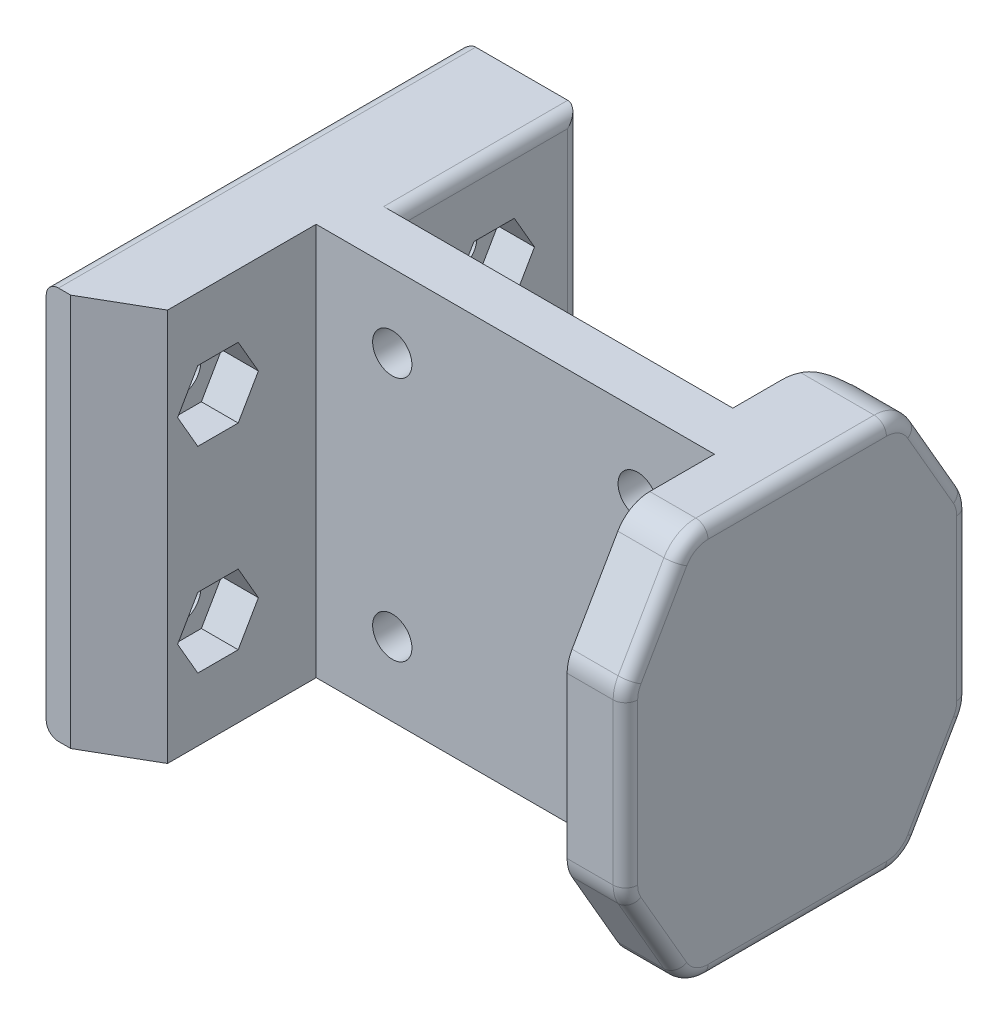
from build123d import *

# Parameters (mm, degrees)
SKETCH_1_W          = 36
SKETCH_1_H          = 32
SKETCH_1_R          = 1.6
EXTRUDE_1_DEPTH     = 4
EXTRUDE_2_DEPTH     = 32
SKETCH_8_R          = 1.6
CUT_EXTRUDE_1_DEPTH = 53.619768148
SKETCH1_W           = 4
SKETCH1_H           = 32
BOSS_EXTRUDE1_DEPTH = 3
SKETCH2_W           = 5
SKETCH2_H           = 32
BOSS_EXTRUDE2_DEPTH = 12
CUT_EXTRUDE1_DEPTH  = 5
BOSS_EXTRUDE5_DEPTH = 5
BOSS_EXTRUDE6_START = 3
SKETCH7_W           = 15
SKETCH7_H           = 32
SKETCH7_R           = 1.6
BOSS_EXTRUDE6_DEPTH = 3
CUT_EXTRUDE2_DEPTH  = 0.25
BOSS_EXTRUDE7_START = 2.5
SKETCH9_W           = 15
SKETCH9_H           = 32
SKETCH9_R           = 1.6
BOSS_EXTRUDE7_DEPTH = 2.5
BOSS_EXTRUDE8_DEPTH = 2.5
CUT_EXTRUDE3_DEPTH  = 2.5
FILLET2_R           = 3
FILLET4_R           = 3
FILLET5_R           = 3
FILLET9_R           = 1
CUT_EXTRUDE4_DEPTH  = 3
CUT_EXTRUDE5_DEPTH  = 3
FILLET14_R          = 1
CHAMFER_1_SIZE      = 5
CHAMFER_1_SIZE2     = 2.886751346


with BuildPart() as part:
    # Эскиз1 → Бобышка-Вытянуть1 (new body)
    with BuildSketch(Plane.XY):
        with Locations((18, 16)):
            Rectangle(SKETCH_1_W, SKETCH_1_H)
        with Locations((8, 26)):
            Circle(SKETCH_1_R, mode=Mode.SUBTRACT)
        with Locations((28, 26)):
            Circle(SKETCH_1_R, mode=Mode.SUBTRACT)
        with Locations((8, 6)):
            Circle(SKETCH_1_R, mode=Mode.SUBTRACT)
        with Locations((28, 6)):
            Circle(SKETCH_1_R, mode=Mode.SUBTRACT)
    extrude(amount=EXTRUDE_1_DEPTH)

    # Эскиз7 → Бобышка-Вытянуть2 (add)
    with BuildSketch(Plane(origin=(0, 32, 0), x_dir=(1, 0, 0), z_dir=(0, 1, 0))):
        Polygon((0, 0), (-1.2, 0), (-1.2, 15), (-5.2, 15), (-5.2, -19), (-1.2, -19), (-1.2, -4), (0, -4), align=None)
    extrude(amount=-EXTRUDE_2_DEPTH)

    # Эскиз8 → Вырез-Вытянуть1 (cut, through all)
    with BuildSketch(Plane(origin=(-1.2, 0, 0), x_dir=(0, 0, -1), z_dir=(1, 0, 0))):
        with Locations(Location((8, 24, 0), (0, 0, 90))):
            Circle(SKETCH_8_R)
        with Locations(Location((8, 8, 0), (0, 0, 90))):
            Circle(SKETCH_8_R)
        with Locations(Location((-12, 8, 0), (0, 0, 90))):
            Circle(SKETCH_8_R)
        with Locations(Location((-12, 24, 0), (0, 0, 90))):
            Circle(SKETCH_8_R)
    extrude(amount=-CUT_EXTRUDE_1_DEPTH, mode=Mode.SUBTRACT)

    # Sketch1 → Boss-Extrude1 (add)
    with BuildSketch(Plane(origin=(36, 0, 0), x_dir=(0, 0, -1), z_dir=(1, 0, 0))):
        with Locations((-2, 16)):
            Rectangle(SKETCH1_W, SKETCH1_H)
    extrude(amount=BOSS_EXTRUDE1_DEPTH)

    # Sketch2 → Boss-Extrude2 (add)
    with BuildSketch(Plane(origin=(0, 0, 0), x_dir=(-1, 0, 0), z_dir=(0, 0, -1))):
        with Locations((-36.5, 16)):
            Rectangle(SKETCH2_W, SKETCH2_H)
    extrude(amount=BOSS_EXTRUDE2_DEPTH)

    # Sketch3 → Cut-Extrude1 (cut)
    with BuildSketch(Plane(origin=(39, 0, 0), x_dir=(0, 0, -1), z_dir=(1, 0, 0))):
        Polygon((7, 32), (12, 32), (12, 23.339745962), align=None)
        Polygon((12, 8.660254038), (7, 0), (12, 0), align=None)
    extrude(amount=-CUT_EXTRUDE1_DEPTH, mode=Mode.SUBTRACT)

    # Sketch6 → Boss-Extrude5 (add)
    with BuildSketch(Plane(origin=(39, 0, 0), x_dir=(0, 0, -1), z_dir=(1, 0, 0))):
        Polygon((-16, 8.660254038), (-11, 0), (-4, 0), (-4, 32), (-11, 32), (-16, 23.339745962), align=None)
    extrude(amount=-BOSS_EXTRUDE5_DEPTH)

    # Sketch7 → Boss-Extrude6 (add)
    # profile 1 of 2: a face of its own
    with BuildSketch(Plane(origin=(-1.2, 0, 0), x_dir=(0, 0, -1), z_dir=(1, 0, 0)).offset(BOSS_EXTRUDE6_START)):
        with Locations((7.5, 16)):
            Rectangle(SKETCH7_W, SKETCH7_H)
        with Locations(Location((8, 24, 0), (0, 0, 90))):
            Circle(SKETCH7_R, mode=Mode.SUBTRACT)
        with Locations(Location((8, 8, 0), (0, 0, 90))):
            Circle(SKETCH7_R, mode=Mode.SUBTRACT)
    # profile 2 of 2: a face of its own
    with BuildSketch(Plane(origin=(-1.2, 0, 0), x_dir=(0, 0, -1), z_dir=(1, 0, 0)).offset(BOSS_EXTRUDE6_START)):
        with Locations((-11.5, 16)):
            Rectangle(SKETCH7_W, SKETCH7_H)
        with Locations(Location((-12, 24, 0), (0, 0, 90))):
            Circle(SKETCH7_R, mode=Mode.SUBTRACT)
        with Locations(Location((-12, 8, 0), (0, 0, 90))):
            Circle(SKETCH7_R, mode=Mode.SUBTRACT)
    extrude(amount=-BOSS_EXTRUDE6_DEPTH)

    # Sketch8 → Cut-Extrude2 (cut)
    with BuildSketch(Plane.ZY.offset(-34)):
        Polygon((-12, 23.339745962), (-12, 8.660254038), (-7, 0), (0, 0), (0, 32), (-7, 32), align=None)
        Polygon((4, 32), (4, 0), (11, 0), (16, 8.660254038), (16, 23.339745962), (11, 32), align=None)
    extrude(amount=-CUT_EXTRUDE2_DEPTH, mode=Mode.SUBTRACT)

    # Sketch9 → Boss-Extrude7 (add)
    with BuildSketch(Plane(origin=(1.8, 0, 0), x_dir=(0, 0, -1), z_dir=(1, 0, 0)).offset(BOSS_EXTRUDE7_START)):
        with Locations((7.5, 16)):
            Rectangle(SKETCH9_W, SKETCH9_H)
        with Locations(Location((8, 24, 0), (0, 0, 90))):
            Circle(SKETCH9_R, mode=Mode.SUBTRACT)
        with Locations(Location((8, 8, 0), (0, 0, 90))):
            Circle(SKETCH9_R, mode=Mode.SUBTRACT)
    extrude(amount=-BOSS_EXTRUDE7_DEPTH)

    # Sketch10 → Boss-Extrude8 (add)
    with BuildSketch(Plane.ZY.offset(-34.25)):
        Polygon((-7, 32), (-12, 23.339745962), (-12, 8.660254038), (-7, 0), (0, 0), (0, 32), align=None)
    extrude(amount=BOSS_EXTRUDE8_DEPTH)

    # Sketch11 → Cut-Extrude3 (cut)
    with BuildSketch(Plane.ZY.offset(-31.75)):
        Polygon((-7, 32), (-12, 23.339745962), (-12, 8.660254038), (-7, 0), align=None)
    extrude(amount=-CUT_EXTRUDE3_DEPTH, mode=Mode.SUBTRACT)

    # Fillet2
    # the kernel refuses this fillet: 3 mm, written as the material it takes off along each edge
    with BuildSketch(Plane(origin=(31.75, -7.395099729, -7), x_dir=(1, 0, 0), z_dir=(0, 1, 0))) as fillet2_piece_1:
        with BuildLine():
            CenterArc((3, -2.958039892), FILLET2_R, 99.594068227, 80.405931773)
            Line((0, -2.958039892), (-0.06, -2.958039892))
            Line((-0.06, -2.958039892), (-0.06, 0))
            Line((-0.06, 0), (0, 0.06))
            ThreePointArc((0, 0.06), (1.25, 0.06), (2.49, 0.059160798))
            Line((2.49, 0.059160798), (2.5, 0))
        make_face()
    extrude(amount=46.790199458, mode=Mode.SUBTRACT)

    # Fillet4
    fillet4_edges = [part.edges().sort_by_distance(p)[0] for p in [
        (36.625, 32, -7),
        (36.625, 0, -7),
        (36.625, 8.660254038, -12),
        (36.625, 23.339745962, -12),
    ]]
    fillet(fillet4_edges, radius=FILLET4_R)

    # Fillet5
    fillet5_edges = [part.edges().sort_by_distance(p)[0] for p in [
        (36.625, 32, 11),
        (36.625, 23.339745962, 16),
        (36.625, 8.660254038, 16),
        (36.625, 0, 11),
    ]]
    fillet(fillet5_edges, radius=FILLET5_R)

    # Fillet9
    fillet9_edges = [part.edges().sort_by_distance(p)[0] for p in [
        (39, 4.732050808, -9.732050808),
        (39, 16, -12),
        (39, 27.267949192, -9.732050808),
        (39, 32, 2),
        (39, 31.598076211, -6.767949192),
        (39, 23.31235552, -11.897777479),
        (39, 8.68764448, -11.897777479),
        (39, 0.401923789, -6.767949192),
        (39, 4.732050808, 13.732050808),
        (39, 0, 2),
        (39, 27.267949192, 13.732050808),
        (39, 16, 16),
        (39, 31.598076211, 10.767949192),
        (39, 23.31235552, 15.897777479),
        (39, 8.68764448, 15.897777479),
        (39, 0.401923789, 10.767949192),
    ]]
    fillet(fillet9_edges, radius=FILLET9_R)

    # Sketch12 → Cut-Extrude4 (cut)
    with BuildSketch(Plane(origin=(4.3, 0, 0), x_dir=(0, 0, -1), z_dir=(1, 0, 0))):
        Polygon((6.354551733, 26.85), (4.709103466, 24), (6.354551733, 21.15), (9.645448267, 21.15), (11.290896534, 24), (9.645448267, 26.85), align=None)
        Polygon((6.354551733, 10.85), (4.709103466, 8), (6.354551733, 5.15), (9.645448267, 5.15), (11.290896534, 8), (9.645448267, 10.85), align=None)
    extrude(amount=-CUT_EXTRUDE4_DEPTH, mode=Mode.SUBTRACT)

    # Sketch13 → Cut-Extrude5 (cut)
    with BuildSketch(Plane(origin=(1.8, 0, 0), x_dir=(0, 0, -1), z_dir=(1, 0, 0))):
        Polygon((-15.290896534, 24), (-13.645448267, 21.15), (-10.354551733, 21.15), (-8.709103466, 24), (-10.354551733, 26.85), (-13.645448267, 26.85), align=None)
        Polygon((-15.290896534, 8), (-13.645448267, 5.15), (-10.354551733, 5.15), (-8.709103466, 8), (-10.354551733, 10.85), (-13.645448267, 10.85), align=None)
    extrude(amount=-CUT_EXTRUDE5_DEPTH, mode=Mode.SUBTRACT)

    # Fillet14
    fillet14_edges = [part.edges().sort_by_distance(p)[0] for p in [
        (4.3, 32, -7.5),
        (4.3, 0, -7.5),
        (4.3, 16, -15),
        (-5.2, 16, -15),
        (-5.2, 32, 2),
        (-5.2, 0, 2),
    ]]
    fillet(fillet14_edges, radius=FILLET14_R)

    # Фаска1
    chamfer_1_edges = [part.edges().sort_by_distance(p)[0] for p in [
        (1.8, 16, 19),
    ]]
    chamfer_1_side = [part.faces().sort_by_distance(p)[0] for p in [
        (-1.693709632, 16, 19),
    ]]
    chamfer(chamfer_1_edges, length=CHAMFER_1_SIZE, length2=CHAMFER_1_SIZE2, reference=chamfer_1_side[0])


solid = part.part
